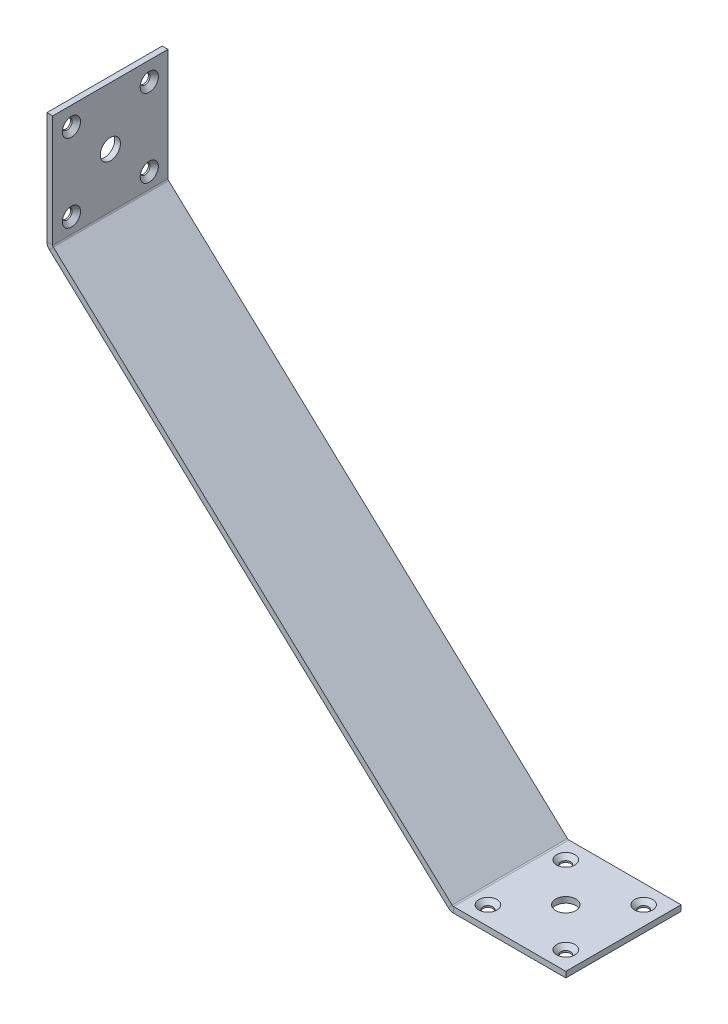
from build123d import *

# Parameters (mm, degrees)
SM_BASE_FLANGE_1_DEPTH              = 40
HOLE_WIZARD_M3_3_AT_2_COUNT         = 2
HOLE_WIZARD_M3_3_AT_2_PITCH         = 27
HOLE_WIZARD_M3_3_AT_3_COUNT         = 2
HOLE_WIZARD_M3_3_AT_3_PITCH         = 38.183766184
HOLE_WIZARD_M3_3_AT_4_COUNT         = 2
HOLE_WIZARD_M3_3_AT_4_PITCH         = 27
HOLE_WIZARD_M3_5_AT_2_COUNT         = 2
HOLE_WIZARD_M3_5_AT_2_PITCH         = 27
HOLE_WIZARD_M3_5_AT_3_COUNT         = 2
HOLE_WIZARD_M3_5_AT_3_PITCH         = 38.183766184
HOLE_WIZARD_M3_5_AT_4_COUNT         = 2
HOLE_WIZARD_M3_5_AT_4_PITCH         = 27
HOLE_WIZARD_7_0_7_1_D               = 7
HOLE_WIZARD_7_0_7_1_DEPTH           = 2
HOLE_WIZARD_7_0_7_1_TIP             = 2.103012167
HOLE_WIZARD_7_0_7_1_ON_FACE_2_D     = 7
HOLE_WIZARD_7_0_7_1_ON_FACE_2_DEPTH = 2
HOLE_WIZARD_7_0_7_1_ON_FACE_2_TIP   = 2.103012167


# Sheet-metal steps are written as plain solids
with BuildPart() as part:
    # Sketch 1 → 基材-凸緣1 (new body)
    with BuildSketch(Plane.XY):
        with BuildLine():
            Line((0, 170), (0, 131.193347828))
            ThreePointArc((0, 131.193347828), (0.228127962, 130.099479649), (0.874477521, 129.187985159))
            Line((0.874477521, 129.187985159), (139.212513644, 0.731237331))
            ThreePointArc((139.212513644, 0.731237331), (140.07436014, 0.189360804), (141.074636122, 0))
            Line((141.074636122, 0), (180, 0))
            Line((180, 0), (180, 2))
            Line((180, 2), (141.074636122, 2))
            ThreePointArc((141.074636122, 2), (140.805395719, 2.050969513), (140.573415842, 2.196824314))
            Line((140.573415842, 2.196824314), (2.23537972, 130.653572142))
            ThreePointArc((2.23537972, 130.653572142), (2.061404318, 130.898915576), (2, 131.193347828))
            Line((2, 131.193347828), (2, 170))
            Line((2, 170), (0, 170))
        make_face()
    extrude(amount=SM_BASE_FLANGE_1_DEPTH)

    # 草圖5 → M3 平錐坑頭螺釘的錐孔3 (revolve, cut)
    with BuildSketch(Plane(origin=(173.5, 2, 6.5), x_dir=(0, 0, 1), z_dir=(1, 0, 0))):
        Polygon((0, 0), (0, 2), (1.7, 2), (1.7, 1.45), (3.15, 0), align=None)
    hole_wizard_m3_3 = revolve(axis=Axis((173.5, 8.35, 6.5), (0, -1, 0)), mode=Mode.SUBTRACT)

    # M3 平錐坑頭螺釘的錐孔3 at 2: M3 平錐坑頭螺釘的錐孔3 ×2
    with Locations(*[(0, 0, i * HOLE_WIZARD_M3_3_AT_2_PITCH) for i in range(1, HOLE_WIZARD_M3_3_AT_2_COUNT)]):
        add(hole_wizard_m3_3, mode=Mode.SUBTRACT)

    # M3 平錐坑頭螺釘的錐孔3 at 3: M3 平錐坑頭螺釘的錐孔3 ×2
    with Locations(*[Vector(-0.7071067811865471, 0, 0.7071067811865479) * (i * HOLE_WIZARD_M3_3_AT_3_PITCH) for i in range(1, HOLE_WIZARD_M3_3_AT_3_COUNT)]):
        add(hole_wizard_m3_3, mode=Mode.SUBTRACT)

    # M3 平錐坑頭螺釘的錐孔3 at 4: M3 平錐坑頭螺釘的錐孔3 ×2
    with Locations(*[(-i * HOLE_WIZARD_M3_3_AT_4_PITCH, 0, 0) for i in range(1, HOLE_WIZARD_M3_3_AT_4_COUNT)]):
        add(hole_wizard_m3_3, mode=Mode.SUBTRACT)

    # 草圖9 → M3 平錐坑頭螺釘的錐孔5 (revolve, cut)
    with BuildSketch(Plane(origin=(2, 163.5, 6.5), x_dir=(0, 0, -1), z_dir=(0, 1, 0))):
        Polygon((0, 0), (0, 2), (1.7, 2), (1.7, 1.45), (3.15, 0), align=None)
    hole_wizard_m3_5 = revolve(axis=Axis((8.35, 163.5, 6.5), (-1, 0, 0)), mode=Mode.SUBTRACT)

    # M3 平錐坑頭螺釘的錐孔5 at 2: M3 平錐坑頭螺釘的錐孔5 ×2
    with Locations(*[(0, -i * HOLE_WIZARD_M3_5_AT_2_PITCH, 0) for i in range(1, HOLE_WIZARD_M3_5_AT_2_COUNT)]):
        add(hole_wizard_m3_5, mode=Mode.SUBTRACT)

    # M3 平錐坑頭螺釘的錐孔5 at 3: M3 平錐坑頭螺釘的錐孔5 ×2
    with Locations(*[Vector(0, -0.7071067811865476, 0.7071067811865476) * (i * HOLE_WIZARD_M3_5_AT_3_PITCH) for i in range(1, HOLE_WIZARD_M3_5_AT_3_COUNT)]):
        add(hole_wizard_m3_5, mode=Mode.SUBTRACT)

    # M3 平錐坑頭螺釘的錐孔5 at 4: M3 平錐坑頭螺釘的錐孔5 ×2
    with Locations(*[(0, 0, i * HOLE_WIZARD_M3_5_AT_4_PITCH) for i in range(1, HOLE_WIZARD_M3_5_AT_4_COUNT)]):
        add(hole_wizard_m3_5, mode=Mode.SUBTRACT)

    # Ø7.0 (7) 直徑孔1
    with Locations(Plane(origin=(2, 150, 20), x_dir=(0, 0, 1), z_dir=(1, 0, 0))):
        with Locations((0, 0)):
            Hole(HOLE_WIZARD_7_0_7_1_D / 2, depth=HOLE_WIZARD_7_0_7_1_DEPTH)
            with Locations((0, 0, -(HOLE_WIZARD_7_0_7_1_DEPTH + HOLE_WIZARD_7_0_7_1_TIP / 2))):  # 118° drill point
                Cone(0, HOLE_WIZARD_7_0_7_1_D / 2, HOLE_WIZARD_7_0_7_1_TIP, mode=Mode.SUBTRACT)

    # Ø7.0 (7) 直徑孔1 on face 2
    with Locations(Plane(origin=(160, 2, 20), x_dir=(0, 0, 1), z_dir=(0, 1, 0))):
        with Locations((0, 0)):
            Hole(HOLE_WIZARD_7_0_7_1_ON_FACE_2_D / 2, depth=HOLE_WIZARD_7_0_7_1_ON_FACE_2_DEPTH)
            with Locations((0, 0, -(HOLE_WIZARD_7_0_7_1_ON_FACE_2_DEPTH + HOLE_WIZARD_7_0_7_1_ON_FACE_2_TIP / 2))):  # 118° drill point
                Cone(0, HOLE_WIZARD_7_0_7_1_ON_FACE_2_D / 2, HOLE_WIZARD_7_0_7_1_ON_FACE_2_TIP, mode=Mode.SUBTRACT)


solid = part.part
